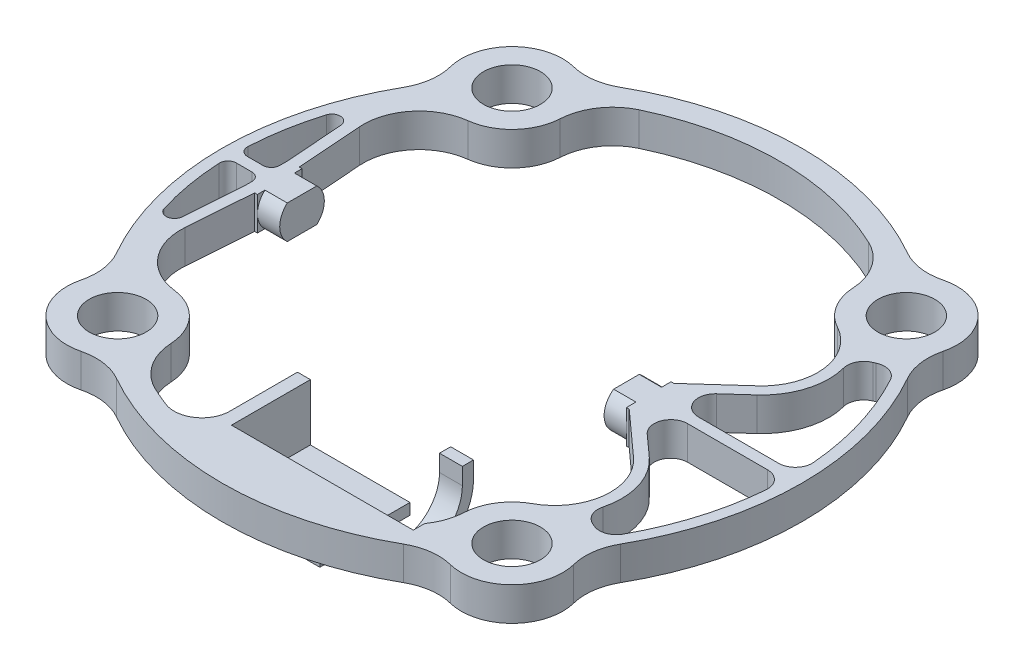
from build123d import *

# Parameters (mm, degrees)
SKETCH1_R            = 5.099999999999963
SKETCH1_R_2          = 5.099999999999999
SKETCH1_R_3          = 5.099999999999977
SKETCH1_R_4          = 5.100000000000024
BOSS_EXTRUDE1_DEPTH  = 6
FILLET1_R            = 10
BOSS_EXTRUDE2_START  = -6
BOSS_EXTRUDE2_DEPTH  = 6
BOSS_EXTRUDE3_START  = -6
BOSS_EXTRUDE3_DEPTH  = 6
FILLET2_R            = 10
CUT_EXTRUDE2_DEPTH   = 6
BOSS_EXTRUDE4_DEPTH  = 6
FILLET3_R            = 3
FILLET4_R            = 3
CUT_EXTRUDE3_START   = -6
CUT_EXTRUDE3_DEPTH   = 6
FILLET5_R            = 1.5
SKETCH8_W            = 13.196102501265209
SKETCH8_H            = 11.55899204058245
SKETCH8_R            = 4
CUT_EXTRUDE4_DEPTH   = 4
SKETCH9_W            = 12.005476711677371
SKETCH9_H            = 14.386728290853053
SKETCH9_R            = 4
CUT_EXTRUDE5_DEPTH   = 4
BOSS_EXTRUDE5_START  = -6
BOSS_EXTRUDE5_DEPTH  = 6
SKETCH11_W           = 2.3146668663284142
SKETCH11_H           = 14.149999999999995
BOSS_EXTRUDE6_DEPTH  = 6.15
BOSS_EXTRUDE7_DEPTH  = 4.1
BOSS_EXTRUDE8_DEPTH  = 6
SKETCH14_W           = 4.100000000000001
SKETCH14_H           = 2
BOSS_EXTRUDE9_DEPTH  = 3
SKETCH15_W           = 14.149999999999995
SKETCH15_H           = 2
BOSS_EXTRUDE10_DEPTH = 17.85
BOSS_EXTRUDE11_DEPTH = 2.25
SKETCH17_R           = 1.500000000000004
CUT_EXTRUDE6_DEPTH   = 3.5
CUT_EXTRUDE7_DEPTH   = 5.500000000000001
FILLET6_R            = 5
FILLET7_R            = 5
FILLET8_R            = 5
CUT_EXTRUDE8_DEPTH   = 13.5
FILLET9_R            = 5


# Some blends are built 0.0001 mm under size
with BuildPart() as part:
    # Sketch1 → Boss-Extrude1 (new body)
    with BuildSketch(Plane(origin=(0, 0, 0), x_dir=(1, 0, 0), z_dir=(0, 1, 0))):
        with BuildLine():
            ThreePointArc((-42.589636171508175, 29.83492736338674), (-52, 6.37e-15), (-42.58963617150818, -29.834927363386726))
            ThreePointArc((-42.58963617150892, -29.834927363386416), (-41.79001076812464, -41.79001076812528), (-29.8349273633857, -42.589636171508374))
            ThreePointArc((-29.834927363385418, -42.5896361715091), (-9.55e-15, -52), (29.834927363385358, -42.589636171509134))
            ThreePointArc((29.83492736338569, -42.58963617150837), (41.790010768124965, -41.79001076812496), (42.58963617150836, -29.834927363385688))
            ThreePointArc((42.58963617150913, -29.834927363385383), (52.00000000000001, 8.2423e-13), (42.58963617150818, 29.83492736338673))
            ThreePointArc((42.58963617150892, 29.834927363386416), (41.790010768124965, 41.79001076812495), (29.834927363386427, 42.58963617150893))
            ThreePointArc((29.834927363386733, 42.58963617150818), (1.066e-14, 52), (-29.83492736338672, 42.58963617150818))
            ThreePointArc((-29.834927363386416, 42.58963617150892), (-41.79001076812496, 41.79001076812496), (-42.58963617150892, 29.83492736338642))
        make_face()
        with Locations(Location((-35.355339059327406, -35.35533905932735, 0), (0, 0, 270))):
            Circle(SKETCH1_R, mode=Mode.SUBTRACT)
        with Locations(Location((35.35533905932738, -35.35533905932738, 0), (0, 0, 270))):
            Circle(SKETCH1_R_2, mode=Mode.SUBTRACT)
        with Locations(Location((-35.3553390593274, 35.35533905932736, 0), (0, 0, 270))):
            Circle(SKETCH1_R_3, mode=Mode.SUBTRACT)
        with BuildLine():
            ThreePointArc((-27.2586404264471, -39.50906885895502), (-28.920667350529797, -28.920667350529794), (-39.50906885895502, -27.2586404264471))
            ThreePointArc((-39.509068858954805, -27.2586404264477), (-48.00000000000001, 5.88e-15), (-39.50906885895479, 27.258640426447702))
            ThreePointArc((-39.50906885895502, 27.2586404264471), (-28.920667350529797, 28.92066735052979), (-27.258640426447098, 39.50906885895501))
            ThreePointArc((-27.258640426447712, 39.50906885895479), (2.94e-15, 48.00000000000001), (27.258640426447723, 39.509068858954784))
            ThreePointArc((27.2586404264471, 39.50906885895501), (28.920667350529794, 28.9206673505298), (39.509068858955004, 27.258640426447098))
            ThreePointArc((39.509068858954784, 27.25864042644773), (48.000000000000014, -3.55e-15), (39.509068858954784, -27.258640426447727))
            ThreePointArc((39.509068858955004, -27.258640426447094), (28.920667350529797, -28.920667350529797), (27.2586404264471, -39.509068858955004))
            ThreePointArc((27.258640426447734, -39.50906885895478), (1.421e-14, -48.000000000000014), (-27.258640426447716, -39.509068858954784))
        make_face(mode=Mode.SUBTRACT)
        with Locations(Location((35.3553390593274, 35.35533905932736, 0), (0, 0, 270))):
            Circle(SKETCH1_R_4, mode=Mode.SUBTRACT)
    extrude(amount=BOSS_EXTRUDE1_DEPTH)

    # Fillet1
    fillet1_edges = [part.edges().sort_by_distance(p)[0] for p in [
        (-42.58963617150856, 3, 29.834927363386576),
        (-42.589636171508545, 3, -29.834927363386583),
        (-29.83492736338657, 3, -42.58963617150856),
        (29.834927363386583, 3, -42.58963617150856),
        (42.58963617150856, 3, -29.834927363386573),
        (42.589636171508744, 3, 29.834927363385535),
        (29.834927363385532, 3, 42.58963617150876),
        (-29.83492736338556, 3, 42.589636171508744),
        (27.258640426447418, 3, 39.50906885895489),
        (39.50906885895489, 3, 27.258640426447414),
        (39.50906885895489, 3, -27.258640426447414),
        (27.258640426447414, 3, -39.50906885895489),
        (-27.2586404264474, 3, -39.509068858954905),
        (-39.509068858954905, 3, -27.2586404264474),
        (-39.50906885895491, 3, 27.2586404264474),
        (-27.258640426447407, 3, 39.509068858954905),
    ]]
    fillet(fillet1_edges, radius=FILLET1_R)

    # Sketch2 → Boss-Extrude2 (add)
    with BuildSketch(Plane(origin=(0, 6, 0), x_dir=(1, 0, 0), z_dir=(0, 1, 0)).offset(BOSS_EXTRUDE2_START)):
        with BuildLine():
            Line((-37.65, 4), (-47.8330429724056, 4))
            ThreePointArc((-47.83304297240559, 3.9999999999999996), (-48, -1.1e-16), (-47.83304297240559, -3.9999999999999982))
            Line((-47.8330429724056, -4), (-37.65, -4))
            Line((-37.65, -4), (-37.65, 4))
        make_face()
        with BuildLine():
            ThreePointArc((47.8330429724056, -4.000000000000002), (48.000000000000014, -1.33e-15), (47.8330429724056, 4))
            Line((47.8330429724056, 4), (20.52, 4))
            Line((20.52, 4), (20.52, -4))
            Line((20.52, -4), (47.8330429724056, -4))
        make_face()
    extrude(amount=BOSS_EXTRUDE2_DEPTH)

    # Sketch3 → Boss-Extrude3 (add)
    with BuildSketch(Plane(origin=(0, 6, 0), x_dir=(1, 0, 0), z_dir=(0, 1, 0)).offset(BOSS_EXTRUDE3_START)):
        with BuildLine():
            Line((-47.8330429724056, 4), (-42.14999999999999, 4))
            Line((-42.14999999999999, 4), (-43.370230256575944, 20.567526042078697))
            ThreePointArc((-43.37023025657595, 20.5675260420787), (-46.34792327288036, 12.484791079196981), (-47.83304297240561, 4.000000000000001))
        make_face()
        with BuildLine():
            Line((-43.37023025657595, -20.56752604207868), (-42.14999999999999, -4))
            Line((-42.14999999999999, -4), (-47.8330429724056, -4))
            ThreePointArc((-47.83304297240559, -4.000000000000008), (-46.34792327288035, -12.48479107919697), (-43.37023025657595, -20.56752604207868))
        make_face()
        with BuildLine():
            Line((43.37023025657595, 20.56752604207868), (25.02, 4))
            Line((25.02, 4), (47.8330429724056, 4))
            ThreePointArc((47.8330429724056, 3.9999999999999982), (46.34792327288036, 12.484791079196969), (43.37023025657596, 20.56752604207868))
        make_face()
        with BuildLine():
            Line((47.8330429724056, -4), (25.02, -4))
            Line((25.02, -4), (43.370230256575944, -20.567526042078697))
            ThreePointArc((43.370230256575944, -20.567526042078704), (46.34792327288036, -12.484791079196986), (47.8330429724056, -4.000000000000007))
        make_face()
    extrude(amount=BOSS_EXTRUDE3_DEPTH)

    # Fillet2
    fillet2_edges = [part.edges().sort_by_distance(p)[0] for p in [
        (43.370230256575944, 2.9999999999999947, 20.567526042078697),
        (43.37023025657595, 2.9999999999999925, -20.56752604207869),
        (-43.37023025657595, 3.000000000000001, 20.56752604207869),
        (-43.37023025657594, 3.000000000000003, -20.567526042078697),
    ]]
    fillet(fillet2_edges, radius=FILLET2_R - 0.0001)  # a hair under: the kernel refuses the full size

    # Sketch5 → Cut-Extrude2 (cut)
    with BuildSketch(Plane(origin=(0, 6, 0), x_dir=(1, 0, 0), z_dir=(0, 1, 0))):
        with BuildLine():
            ThreePointArc((38.237657421795525, 18.57207711307228), (37.20349447624699, 13.698637086230962), (34.27925447259233, 9.665185574908357))
            Line((34.27925447259233, 9.665185574908358), (27.020000000000003, 3.1111595033373005))
            Line((27.020000000000003, 3.1111595033373), (27.020000000000003, -3.1111595033471926))
            Line((27.020000000000003, -3.111159503347192), (34.27925447258564, -9.66518557490234))
            ThreePointArc((34.27925447258564, -9.665185574902342), (37.20349447624515, -13.698637086226856), (38.237657421795504, -18.572077113072286))
            ThreePointArc((38.237657421795504, -18.57207711307229), (37.86190003304607, -21.55150385571701), (36.75816013599775, -24.34434032956399))
            ThreePointArc((36.75816013599784, -24.344340329564076), (39.68242206988196, -25.133482446178775), (42.28449514351011, -26.68373044494484))
            ThreePointArc((42.284495143510036, -26.683730444944835), (48.03240966876168, -13.888398806638916), (50, -1.225e-14))
            ThreePointArc((50, 0), (48.03240966876169, 13.888398806638897), (42.28449514351005, 26.68373044494482))
            ThreePointArc((42.28449514351011, 26.68373044494484), (39.682422069881966, 25.133482446178775), (36.75816013599786, 24.344340329564076))
            ThreePointArc((36.75816013599777, 24.344340329563988), (37.8619000330461, 21.551503855717), (38.237657421795525, 18.572077113072282))
        make_face()
    extrude(amount=-CUT_EXTRUDE2_DEPTH, mode=Mode.SUBTRACT)

    # Sketch6 → Boss-Extrude4 (add)
    with BuildSketch(Plane(origin=(0, 6, 0), x_dir=(1, 0, 0), z_dir=(0, 1, 0))):
        Polygon((27.020000000000003, 0.9819090006175923), (49.99035761738963, 0.9819090006175919), (51.19424294426267, 0.9819090006175919), (51.19424294426267, -1.018090999382408), (49.989633832595494, -1.018090999382408), (27.020000000000003, -1.0180909993824077), align=None)
    extrude(amount=-BOSS_EXTRUDE4_DEPTH)

    # Fillet3
    # the kernel refuses this fillet: 3 mm, written as the material it adds along each edge
    with BuildSketch(Plane(origin=(27.020000000000003, 6, -0.9819090006175923), x_dir=(0, 0, -1), z_dir=(0, -1, 0))) as fillet3_piece_1:
        with BuildLine():
            CenterArc((3, 2.8708527153070946), FILLET3_R, 180, 73.12708628528327)
            Line((-2.2e-16, 2.8708527153070946), (-0.06000000000000028, 2.8708527153070946))
            Line((-0.06000000000000028, 2.8708527153070946), (-0.06000000000000005, 0))
            Line((-0.06000000000000005, 0), (0, -0.05999999999999872))
            ThreePointArc((0, -0.05999999999999872), (1.064625251359854, -0.05999999999999872), (2.1118355127741024, -0.05741705430614275))
            Line((2.1118355127741024, -0.05741705430614275), (2.1292505027197084, 0))
        make_face()
    extrude(amount=6)
    with BuildSketch(Plane(origin=(27.020000000000003, 6, 1.0180909993824077), x_dir=(0, 0, 1), z_dir=(0, -1, 0))) as fillet3_piece_2:
        with BuildLine():
            CenterArc((3, -2.859628518094496), FILLET3_R, 107.596430009701, 72.403569990299)
            Line((2.2e-16, -2.859628518094496), (-0.05999999999999983, -2.859628518094496))
            Line((-0.05999999999999983, -2.859628518094496), (-0.06000000000000005, 0))
            Line((-0.06000000000000005, 0), (0, 0.05999999999999872))
            ThreePointArc((0, 0.05999999999999872), (1.0465342519823924, 0.05999999999999872), (2.07492987404408, 0.05719257036189163))
            Line((2.07492987404408, 0.05719257036189163), (2.0930685039647843, 0))
        make_face()
    extrude(amount=6)
    with BuildSketch(Plane(origin=(36.7581601359978, 6, 24.344340329564034), x_dir=(0.3686768777675154, 0, -0.9295576151049468), z_dir=(0, -1, 0))) as fillet3_piece_3:
        with BuildLine():
            CenterArc((3.345716556141784, 2.976878348256868), FILLET3_R, 180.89962430391978, 81.98224825656462)
            Line((0.3460863497763565, 2.9297760652963665), (0.28609374564904577, 2.928834019637155))
            ThreePointArc((0.28609374564904577, 2.928834019637155), (0.21122512417191133, 1.4603777045000785), (-0.05812186710148964, 0.01489458172076869))
            Line((-0.05812186710148964, 0.01489458172076869), (0.00743492568031723, -0.05953756696513596))
            ThreePointArc((0.00743492568031723, -0.05953756696513596), (1.4869851360630424, 0.03248660697253327), (2.966535346445779, -0.05953756696513431))
            Line((2.966535346445779, -0.05953756696513431), (2.973970272126092, -1.5e-16))
        make_face()
    extrude(amount=6)
    with BuildSketch(Plane(origin=(42.28449514351007, 6, 26.68373044494484), x_dir=(-0.8512706925591004, 0, -0.5247267936649983), z_dir=(0, -1, 0))) as fillet3_piece_4:
        with BuildLine():
            CenterArc((3.0611464220846627, 2.97778381773632), FILLET3_R, 177.01132377378212, 86.01149357067823)
            Line((0.06522684574595612, 3.1341995845583397), (0.00530845421918353, 3.1373278998947787))
            ThreePointArc((0.00530845421918353, 3.1373278998947787), (-0.05194296104754635, 1.5688595226543562), (-0.05999666374167063, -0.00063272416503647))
            Line((-0.05999666374167063, -0.00063272416503647), (0.00728844386210776, -0.05955567635472604))
            ThreePointArc((0.00728844386210776, -0.05955567635472604), (1.3483621144896634, 0.02219987437561363), (2.689435785117221, -0.05955567635472756))
            Line((2.689435785117221, -0.05955567635472756), (2.696724228979326, 2e-17))
        make_face()
    extrude(amount=6)
    with BuildSketch(Plane(origin=(49.9896338325955, 0, 1.018090999382408), x_dir=(-0.0529547236137434, 0, 0.9985969142987535), z_dir=(0, 1, 0))) as fillet3_piece_5:
        with BuildLine():
            CenterArc((3.1632179426355167, -2.998404409178422), FILLET3_R, 88.13122498852314, 94.90427700248017)
            Line((0.16742719973925577, -3.157268580019652), (0.1075113848813305, -3.1604458634364767))
            Line((0.1075113848813305, -3.1604458634364767), (-0.05991581485792526, -0.00317728341682461))
            Line((-0.05991581485792526, -0.00317728341682461), (-0.00195662965523841, 0.05996808818356544))
            ThreePointArc((-0.00195662965523841, 0.05996808818356544), (1.6305247126987177, 0.08659318035961931), (3.2630060550526774, 0.05996808818356832))
            Line((3.2630060550526774, 0.05996808818356832), (3.261049425397439, 0))
        make_face()
    extrude(amount=6)
    with BuildSketch(Plane(origin=(49.99035761738964, 0, -0.9819090006175919), x_dir=(-0.05220754978421727, 0, -0.9986362559738798), z_dir=(0, 1, 0))) as fillet3_piece_6:
        with BuildLine():
            CenterArc((3.160850062556177, 2.99840679773152), FILLET3_R, 177.00736721989773, 94.86000839284759)
            Line((0.16494129463453752, 3.1550294470841647), (0.10502311927610468, 3.1581619000712178))
            Line((0.10502311927610468, 3.1581619000712178), (-0.05991817535843284, 0.00313245298705304))
            Line((-0.05991817535843284, 0.00313245298705304), (-0.00195516498714811, -0.05996813595462845))
            ThreePointArc((-0.00195516498714811, -0.05996813595462845), (1.629304155956785, -0.08655337114138394), (3.2605634769007272, -0.05996813595463082))
            Line((3.2605634769007272, -0.05996813595463082), (3.2586083119135796, 0))
        make_face()
    extrude(amount=6)
    with BuildSketch(Plane(origin=(36.75816013599781, 6, -24.34434032956403), x_dir=(0.3686768777675187, 0, 0.9295576151049456), z_dir=(0, -1, 0))) as fillet3_piece_7:
        with BuildLine():
            CenterArc((3.3457165561417908, -2.9768783482568657), FILLET3_R, 97.11812743951585, 81.9822482565646)
            Line((0.34608634977635955, -2.9297760652963762), (0.2860937456490488, -2.9288340196371645))
            ThreePointArc((0.2860937456490488, -2.9288340196371645), (0.21122512417191577, -1.4603777045000856), (-0.05812186710148959, -0.0148945817207689))
            Line((-0.05812186710148959, -0.0148945817207689), (0.00743492568031702, 0.05953756696513599))
            ThreePointArc((0.00743492568031702, 0.05953756696513599), (1.486985136063038, -0.03248660697254525), (2.9665353464457715, 0.05953756696513415))
            Line((2.9665353464457715, 0.05953756696513415), (2.973970272126085, -5e-17))
        make_face()
    extrude(amount=6)
    with BuildSketch(Plane(origin=(42.284495143510085, 6, -26.683730444944832), x_dir=(0.5069009623645678, 0, 0.8620043006585727), z_dir=(0, -1, 0))) as fillet3_piece_8:
        with BuildLine():
            CenterArc((3.040831892432753, 2.998525518414092), FILLET3_R, 185.78495367741579, 86.01149357067038)
            Line((0.05611025432539941, 2.69614042781974), (-0.00358417843674884, 2.690092726007855))
            ThreePointArc((-0.00358417843674884, 2.690092726007855), (0.05025019559160608, 1.3476083051303924), (-0.0593911340901195, 0.00852603023038361))
            Line((-0.0593911340901195, 0.00852603023038361), (-0.00188092694377259, -0.05997051036828272))
            ThreePointArc((-0.00188092694377259, -0.05997051036828272), (1.5674391198106752, -0.08457469309852138), (3.1367591665651227, -0.05997051036828362))
            Line((3.1367591665651227, -0.05997051036828362), (3.13487823962135, -1.7e-16))
        make_face()
    extrude(amount=6)

    # Fillet4
    fillet4_edges = [part.edges().sort_by_distance(p)[0] for p in [
        (27.020000000000003, 3, -3.1111595033373005),
    ]]
    fillet(fillet4_edges, radius=FILLET4_R)
    fillet4_2_edges = [part.edges().sort_by_distance(p)[0] for p in [
        (27.020000000000003, 3, 3.111159503347192),
    ]]
    fillet(fillet4_2_edges, radius=FILLET4_R)

    # Sketch7 → Cut-Extrude3 (cut)
    with BuildSketch(Plane.XZ.offset(CUT_EXTRUDE3_START)):
        with BuildLine():
            Line((-44.14999999999999, 3.9264476838978197), (-45.403197170618576, 20.941577941643605))
            ThreePointArc((-45.40319717061856, 20.94157794164361), (-48.72763180786275, 11.20793907894589), (-49.98999899979993, 1.000000000001045))
            Line((-49.98999899979991, 0.9999999999999938), (-44.14999999999999, 0.9999999999999946))
            Line((-44.14999999999999, 0.9999999999999947), (-44.14999999999999, 3.9264476838978197))
        make_face()
        with BuildLine():
            ThreePointArc((-49.98999899979993, -1.0000000000010327), (-48.72763180786276, -11.207939078945877), (-45.403197170618554, -20.941577941643637))
            Line((-45.40319717061855, -20.941577941643633), (-44.14999999999999, -3.9264476838977123))
            Line((-44.14999999999999, -3.9264476838977123), (-44.14999999999999, -1))
            Line((-44.14999999999999, -1), (-49.98999899979991, -1))
        make_face()
    extrude(amount=CUT_EXTRUDE3_DEPTH, mode=Mode.SUBTRACT)

    # Fillet5
    # the kernel refuses this fillet: 1.5 mm, written as the material it adds along each edge
    with BuildSketch(Plane(origin=(-45.40319717061857, 6, 20.941577941643608), x_dir=(-0.35566095703559125, 0, -0.9346150456955673), z_dir=(0, -1, 0))) as fillet5_piece_1:
        with BuildLine():
            CenterArc((6.745613455376667, 1.4964783855270851), FILLET5_R, 115.0462972690573, 158.88058526223008)
            Line((6.110587770722799, 2.855427383771646), (0, 0))
            ThreePointArc((0, 0), (3.4241692666886636, -0.11738714909708475), (6.848338533377325, 3e-17))
        make_face()
    extrude(amount=6)
    with BuildSketch(Plane(origin=(-44.14999999999999, 6, 3.9264476838978197), x_dir=(-0.07345297200060777, 0, 0.9972986818923797), z_dir=(0, -1, 0))) as fillet5_piece_2:
        with BuildLine():
            CenterArc((FILLET5_R * 0.0367761580511, FILLET5_R), FILLET5_R, 265.78766107236066, 4.212338927640246)
            Line((-FILLET5_R * 0.0366768139495, FILLET5_R * 0.00270131810762), (0, 0))
            Line((0, 0), (FILLET5_R * 0.0367761580511, 0))
        make_face()
    extrude(amount=6)
    with BuildSketch(Plane(origin=(-44.14999999999999, 6, 0.9999999999999947), x_dir=(0, 0, 1), z_dir=(0, -1, 0))) as fillet5_piece_3:
        with BuildLine():
            CenterArc((FILLET5_R, FILLET5_R), FILLET5_R, 180, 90)
            Line((0, FILLET5_R), (0, 0))
            Line((0, 0), (FILLET5_R, 0))
        make_face()
    extrude(amount=6)
    with BuildSketch(Plane(origin=(-49.98999899979992, 6, 1.0000000000005203), x_dir=(0.0357776524855417, 0, 0.9993597748471889), z_dir=(0, -1, 0))) as fillet5_piece_4:
        with BuildLine():
            CenterArc((1.5546551231276617, -1.4998131539261013), FILLET5_R, 89.09564593035947, 92.95470013766749)
            Line((0.05561546085687804, -1.5534796326543996), (0, 0))
            ThreePointArc((0, 0), (0.7891650371206554, 0.00622820246320295), (1.5783300742413102, 0))
        make_face()
    extrude(amount=6)
    with BuildSketch(Plane(origin=(-49.98999899979992, 6, -1.0000000000005165), x_dir=(1, 0, 3.3225e-13), z_dir=(0, -1, 0))) as fillet5_piece_5:
        with BuildLine():
            CenterArc((1.554474846550007, -1.5), FILLET5_R, 89.99999999998097, 92.95470013766811)
            ThreePointArc((0.0564689449030968, -1.57731958762837), (0.02201025744025821, -0.7888826242775202), (0, 0))
            Line((0, 0), (1.5544748465505052, 0))
        make_face()
    extrude(amount=6)
    with BuildSketch(Plane(origin=(-44.14999999999999, 6, -1), x_dir=(-1, 0, 0), z_dir=(0, -1, 0))) as fillet5_piece_6:
        with BuildLine():
            CenterArc((FILLET5_R, FILLET5_R), FILLET5_R, 180, 90)
            Line((0, FILLET5_R), (0, 0))
            Line((0, 0), (FILLET5_R, 0))
        make_face()
    extrude(amount=6)
    with BuildSketch(Plane(origin=(-44.14999999999999, 6, -3.9264476838977123), x_dir=(0, 0, 1), z_dir=(0, -1, 0))) as fillet5_piece_7:
        with BuildLine():
            CenterArc((FILLET5_R * 0.0367761580511, FILLET5_R), FILLET5_R, 265.78766107236, 4.212338927640019)
            Line((-FILLET5_R * 0.0366768139495, FILLET5_R * 0.00270131810762), (0, 0))
            Line((0, 0), (FILLET5_R * 0.0367761580511, 0))
        make_face()
    extrude(amount=6)
    with BuildSketch(Plane(origin=(-45.40319717061855, 6, -20.941577941643637), x_dir=(0.07345297200062204, 0, 0.9972986818923786), z_dir=(0, -1, 0))) as fillet5_piece_8:
        with BuildLine():
            CenterArc((6.744831239378959, 1.5000000000000004), FILLET5_R, 111.11941473771157, 158.8805852622885)
            ThreePointArc((6.204361859716742, 2.8992472439306565), (3.052485026709371, 1.5559723877450613), (0, 0))
            Line((0, 0), (6.744831239378961, -2e-17))
        make_face()
    extrude(amount=6)

    # Sketch8 → Cut-Extrude4 (cut)
    with BuildSketch(Plane(origin=(-37.65, 0, 0), x_dir=(0, 0, -1), z_dir=(1, 0, 0))):
        with Locations((0, 2.9999999999999996)):
            Rectangle(SKETCH8_W, SKETCH8_H)
        with Locations((0, 3)):
            Circle(SKETCH8_R, mode=Mode.SUBTRACT)
    extrude(amount=-CUT_EXTRUDE4_DEPTH, mode=Mode.SUBTRACT)

    # Sketch9 → Cut-Extrude5 (cut)
    with BuildSketch(Plane.ZY.offset(-20.52)):
        with Locations((0, 2.727148256552649)):
            Rectangle(SKETCH9_W, SKETCH9_H)
        with Locations((0, 2.7271482565526486)):
            Circle(SKETCH9_R, mode=Mode.SUBTRACT)
    extrude(amount=-CUT_EXTRUDE5_DEPTH, mode=Mode.SUBTRACT)

    # Sketch10 → Boss-Extrude5 (add)
    with BuildSketch(Plane(origin=(0, 6, 0), x_dir=(1, 0, 0), z_dir=(0, 1, 0)).offset(BOSS_EXTRUDE5_START)):
        with BuildLine():
            Line((-10.464666866328413, -28), (-10.464666866328413, -46.84539195456443))
            ThreePointArc((-10.464666866328413, -46.84539195456443), (4.459052848216454, -47.7924350467395), (18.95000000000001, -44.100992052333716))
            Line((18.95000000000001, -44.100992052333716), (18.95000000000001, -42.15))
            Line((18.95000000000001, -42.15), (14.700000000000006, -42.15))
            Line((14.700000000000006, -42.15), (-8.149999999999999, -42.15))
            Line((-8.149999999999999, -42.15), (-8.149999999999997, -28))
            Line((-8.149999999999997, -28), (-10.464666866328413, -28))
        make_face()
    extrude(amount=BOSS_EXTRUDE5_DEPTH)

    # Sketch11 → Boss-Extrude6 (add)
    with BuildSketch(Plane.XZ):
        Polygon((-10.464666866328413, 44.15), (-10.464666866328413, 42.15), (-8.149999999999999, 42.15), (9.700000000000005, 42.15), (9.700000000000005, 44.15), align=None)
        with Locations((-9.307333433164207, 35.075)):
            Rectangle(SKETCH11_W, SKETCH11_H)
    extrude(amount=BOSS_EXTRUDE6_DEPTH)

    # Sketch12 → Boss-Extrude7 (add)
    with BuildSketch(Plane(origin=(18.95000000000001, 0, 0), x_dir=(0, 0, -1), z_dir=(1, 0, 0))):
        with BuildLine():
            Line((-25.850000000000005, 3), (-27.85, 3))
            ThreePointArc((-27.85, 2.9999999999999982), (-35, -4.149999999999999), (-42.15, 3.000000000000001))
            Line((-42.15, 3.000000000000028), (-42.15, 0))
            Line((-42.15, 0), (-43.644217720534414, 0))
            ThreePointArc((-43.644217720534385, 1.1768e-13), (-33.478831393778066, -6.022668456251997), (-25.85, 2.999999999999998))
        make_face()
    extrude(amount=-BOSS_EXTRUDE7_DEPTH)

    # Sketch13 → Boss-Extrude8 (add)
    with BuildSketch(Plane(origin=(0, 6, 0), x_dir=(1, 0, 0), z_dir=(0, 1, 0))):
        Polygon((18.95000000000001, -42.15), (24.139354243800483, -42.15), (18.95000000000001, -46.44899679624902), align=None)
    extrude(amount=-BOSS_EXTRUDE8_DEPTH)

    # Sketch14 → Boss-Extrude9 (add)
    with BuildSketch(Plane(origin=(0, 3, 0), x_dir=(1, 0, 0), z_dir=(0, 1, 0))):
        with Locations((16.90000000000001, -26.85000000000001)):
            Rectangle(SKETCH14_W, SKETCH14_H)
    extrude(amount=BOSS_EXTRUDE9_DEPTH)

    # Sketch15 → Boss-Extrude10 (add)
    with BuildSketch(Plane(origin=(-8.149999999999993, 0, -1e-15), x_dir=(1.2e-16, 0, -1), z_dir=(1, 0, 1.2e-16))):
        with Locations((-35.075, -5.15)):
            Rectangle(SKETCH15_W, SKETCH15_H)
    extrude(amount=BOSS_EXTRUDE10_DEPTH)

    # Sketch16 → Boss-Extrude11 (add)
    with BuildSketch(Plane(origin=(0, -6.15, 0), x_dir=(-1, 0, 0), z_dir=(0, -1, 0))):
        Polygon((-9.700000000000003, -42.15), (-4.700000000000002, -42.15), (-4.700000000000003, -28), (-9.700000000000003, -28.000000000000004), align=None)
    extrude(amount=BOSS_EXTRUDE11_DEPTH)

    # Sketch17 → Cut-Extrude6 (cut)
    with BuildSketch(Plane(origin=(9.700000000000005, 0, 0), x_dir=(0, 0, -1), z_dir=(1, 0, 0))):
        with Locations((-35.42111724023818, -6.275)):
            Circle(SKETCH17_R)
    extrude(amount=-CUT_EXTRUDE6_DEPTH, mode=Mode.SUBTRACT)

    # Sketch18 → Cut-Extrude7 (cut)
    with BuildSketch(Plane(origin=(9.700000000000005, 0, 0), x_dir=(0, 0, -1), z_dir=(1, 0, 0))):
        with BuildLine():
            Line((-37.542437583797835, -6.15), (-42.15, -6.15))
            Line((-42.15, -6.15), (-42.15, -8.4))
            Line((-42.15, -8.4), (-35.421117240238374, -8.4))
            ThreePointArc((-35.421117240238374, -8.400000000000002), (-36.96728184984486, -7.7327379737112745), (-37.54243758379783, -6.150000000000048))
        make_face()
        with BuildLine():
            Line((-28, -6.15), (-33.299796896678544, -6.15))
            ThreePointArc((-33.29979689667854, -6.149999999999951), (-33.29703735355027, -6.212472926120896), (-33.29611724023818, -6.275))
            ThreePointArc((-33.29611724023818, -6.275000000000001), (-33.918515330216835, -7.777601910021484), (-35.421117240238374, -8.400000000000002))
            Line((-35.421117240238374, -8.4), (-28.000000000000004, -8.4))
            Line((-28.000000000000004, -8.4), (-28, -6.15))
        make_face()
    extrude(amount=-CUT_EXTRUDE7_DEPTH, mode=Mode.SUBTRACT)

    # Fillet6
    fillet6_edges = [part.edges().sort_by_distance(p)[0] for p in [
        (7.200000000000003, -6.150000000000024, 37.542437583797835),
        (7.200000000000004, -6.1499999999999755, 33.299796896678544),
    ]]
    fillet(fillet6_edges, radius=FILLET6_R)

    # Fillet7
    # the kernel refuses this fillet: 5 mm, written as the material it adds along each edge
    with BuildSketch(Plane(origin=(9.700000000000005, 0, 44.15), x_dir=(0, -1, 0), z_dir=(-1, 0, 0))) as fillet7_piece_1:
        with BuildLine():
            CenterArc((FILLET7_R, FILLET7_R), FILLET7_R, 179.99999999999991, 90.00000000000011)
            Line((-8.9e-16, FILLET7_R), (0, 0))
            Line((0, 0), (FILLET7_R, 0))
        make_face()
    extrude(amount=20.164666866328417)

    # Fillet8
    fillet8_edges = [part.edges().sort_by_distance(p)[0] for p in [
        (-10.464666866328415, 3, 46.845391954564434),
    ]]
    fillet(fillet8_edges, radius=FILLET8_R)

    # Sketch19 → Cut-Extrude8 (cut)
    with BuildSketch(Plane(origin=(0, 6, 0), x_dir=(1, 0, 0), z_dir=(0, 1, 0))):
        Polygon((18.95000000000001, -25.850000000000005), (24.450000000000006, -25.850000000000005), (24.45000000000001, -42.15), (18.950000000000014, -42.15), align=None)
    extrude(amount=-CUT_EXTRUDE8_DEPTH, mode=Mode.SUBTRACT)

    # Fillet9
    fillet9_edges = [part.edges().sort_by_distance(p)[0] for p in [
        (16.90000000000001, 5.884e-14, 43.6442177205344),
    ]]
    fillet(fillet9_edges, radius=FILLET9_R)


solid = part.part
